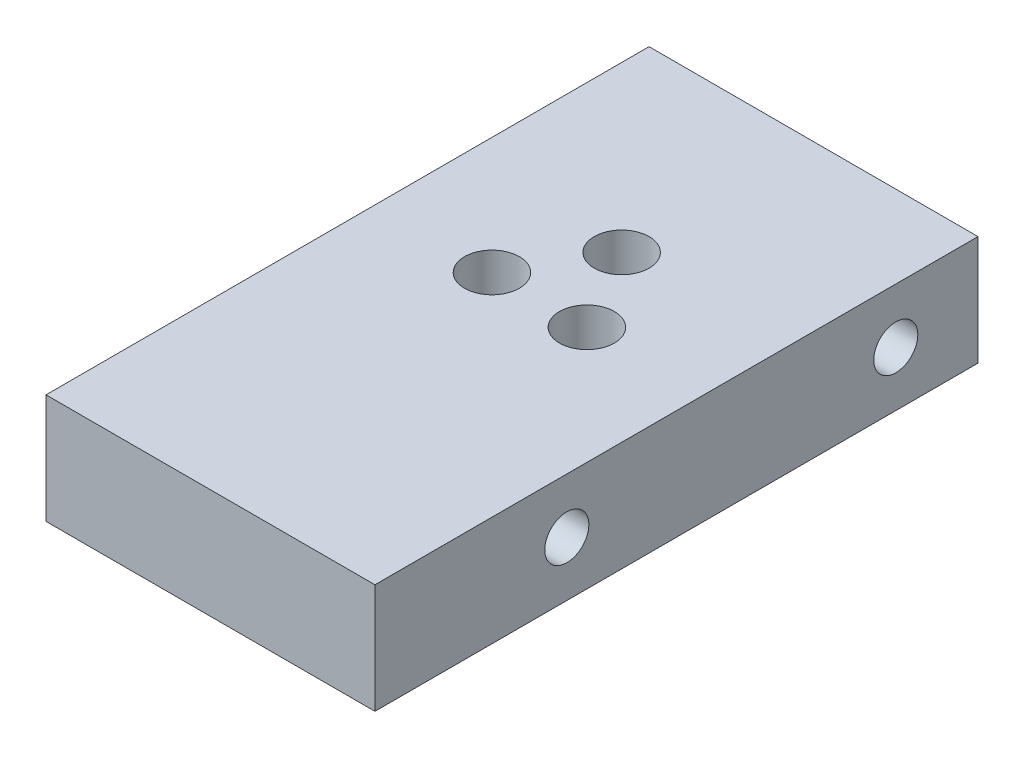
from build123d import *

# Parameters (mm, degrees)
SKETCH1_W                             = 38.1
SKETCH1_H                             = 69.85
BOSS_EXTRUDE1_DEPTH                   = 12.7
F_1_4_0_25_DIAMETER_HOLE1_D           = 6.35
F_1_4_0_25_DIAMETER_HOLE1_DEPTH       = 17.018
F_1_4_0_25_DIAMETER_HOLE1_TIP         = 1.907732465
F_1_4_20_TAPPED_HOLE1_D               = 5.1054
F_1_4_20_TAPPED_HOLE1_DEPTH           = 16.51
F_1_4_20_TAPPED_HOLE1_TIP             = 1.533816902
F_1_4_20_TAPPED_HOLE1_ON_FACE_2_D     = 5.1054
F_1_4_20_TAPPED_HOLE1_ON_FACE_2_DEPTH = 16.51
F_1_4_20_TAPPED_HOLE1_ON_FACE_2_TIP   = 1.533816902
CUT_EXTRUDE1_DEPTH                    = 3.81


with BuildPart() as part:
    # Sketch1 → Boss-Extrude1 (new body)
    with BuildSketch(Plane(origin=(0, 0, 0), x_dir=(1, 0, 0), z_dir=(0, 1, 0))):
        Rectangle(SKETCH1_W, SKETCH1_H)
    extrude(amount=BOSS_EXTRUDE1_DEPTH)

    # 1/4 (0.25) Diameter Hole1
    with Locations(Plane(origin=(0, 0, 0), x_dir=(-1, 0, 0), z_dir=(0, -1, 0))):
        with Locations((0, 12.7), (5.499261314, 3.175), (-5.499261314, 3.175)):
            Hole(F_1_4_0_25_DIAMETER_HOLE1_D / 2, depth=F_1_4_0_25_DIAMETER_HOLE1_DEPTH)
            with Locations((0, 0, -(F_1_4_0_25_DIAMETER_HOLE1_DEPTH + F_1_4_0_25_DIAMETER_HOLE1_TIP / 2))):  # 118° drill point
                Cone(0, F_1_4_0_25_DIAMETER_HOLE1_D / 2, F_1_4_0_25_DIAMETER_HOLE1_TIP, mode=Mode.SUBTRACT)

    # 1/4-20 Tapped Hole1
    with Locations(Plane(origin=(-19.05, 6.35, -25.4), x_dir=(0, 0, -1), z_dir=(-1, 0, 0))):
        with Locations((0, 0), (-38.1, 0)):
            Hole(F_1_4_20_TAPPED_HOLE1_D / 2, depth=F_1_4_20_TAPPED_HOLE1_DEPTH)
            with Locations((0, 0, -(F_1_4_20_TAPPED_HOLE1_DEPTH + F_1_4_20_TAPPED_HOLE1_TIP / 2))):  # 118° drill point
                Cone(0, F_1_4_20_TAPPED_HOLE1_D / 2, F_1_4_20_TAPPED_HOLE1_TIP, mode=Mode.SUBTRACT)

    # 1/4-20 Tapped Hole1 on face 2
    with Locations(Plane(origin=(19.05, 6.35, 12.7), x_dir=(0, 0, 1), z_dir=(1, 0, 0))):
        with Locations((0, 0), (-38.1, 0)):
            Hole(F_1_4_20_TAPPED_HOLE1_ON_FACE_2_D / 2, depth=F_1_4_20_TAPPED_HOLE1_ON_FACE_2_DEPTH)
            with Locations((0, 0, -(F_1_4_20_TAPPED_HOLE1_ON_FACE_2_DEPTH + F_1_4_20_TAPPED_HOLE1_ON_FACE_2_TIP / 2))):  # 118° drill point
                Cone(0, F_1_4_20_TAPPED_HOLE1_ON_FACE_2_D / 2, F_1_4_20_TAPPED_HOLE1_ON_FACE_2_TIP, mode=Mode.SUBTRACT)

    # Sketch5 → Cut-Extrude1 (cut)
    with BuildSketch(Plane.XZ):
        with BuildLine():
            Line((10.998522628, -6.35), (5.499261314, -15.875))
            ThreePointArc((5.499261314, -15.875), (0, -19.05), (-5.499261314, -15.875))
            Line((-5.499261314, -15.875), (-10.998522628, -6.35))
            ThreePointArc((-10.998522628, -6.35), (-10.998522628, 0), (-5.499261314, 3.175))
            Line((-5.499261314, 3.175), (5.499261314, 3.175))
            ThreePointArc((5.499261314, 3.175), (10.998522628, 0), (10.998522628, -6.35))
        make_face()
    extrude(amount=-CUT_EXTRUDE1_DEPTH, mode=Mode.SUBTRACT)


solid = part.part
